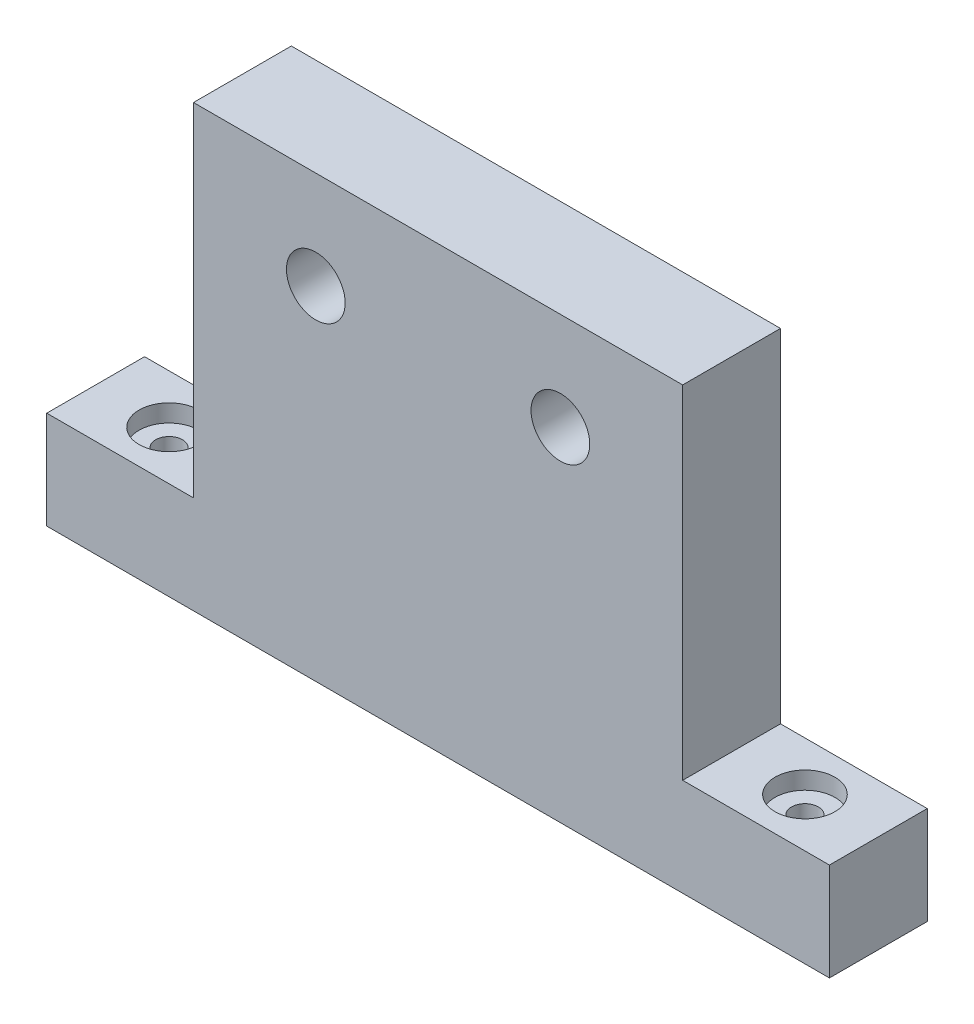
from build123d import *

# Parameters (mm, degrees)
SKETCH2_R              = 6
CORPO_FUROS_12MM_DEPTH = 20
FUROS_6MM_D            = 5.5
FUROS_6MM_CBORE_D      = 12.24
FUROS_6MM_CBORE_DEPTH  = 3.58


with BuildPart() as part:
    # Sketch2 → Corpo - Furos 12mm (new body)
    with BuildSketch(Plane.XY):
        Polygon((80, 0), (-80, 0), (-80, 20), (-50, 20), (-50, 90), (0, 90), (50, 90), (50, 20), (80, 20), align=None)
        with Locations((-25, 70)):
            Circle(SKETCH2_R, mode=Mode.SUBTRACT)
        with Locations((25, 70)):
            Circle(SKETCH2_R, mode=Mode.SUBTRACT)
    extrude(amount=CORPO_FUROS_12MM_DEPTH)

    # Furos Ø6mm (through all)
    with Locations(Plane(origin=(0, 20, 0), x_dir=(1, 0, 0), z_dir=(0, 1, 0))):
        with Locations((-65, -10), (65, -10)):
            CounterBoreHole(FUROS_6MM_D / 2, FUROS_6MM_CBORE_D / 2, FUROS_6MM_CBORE_DEPTH)


solid = part.part
